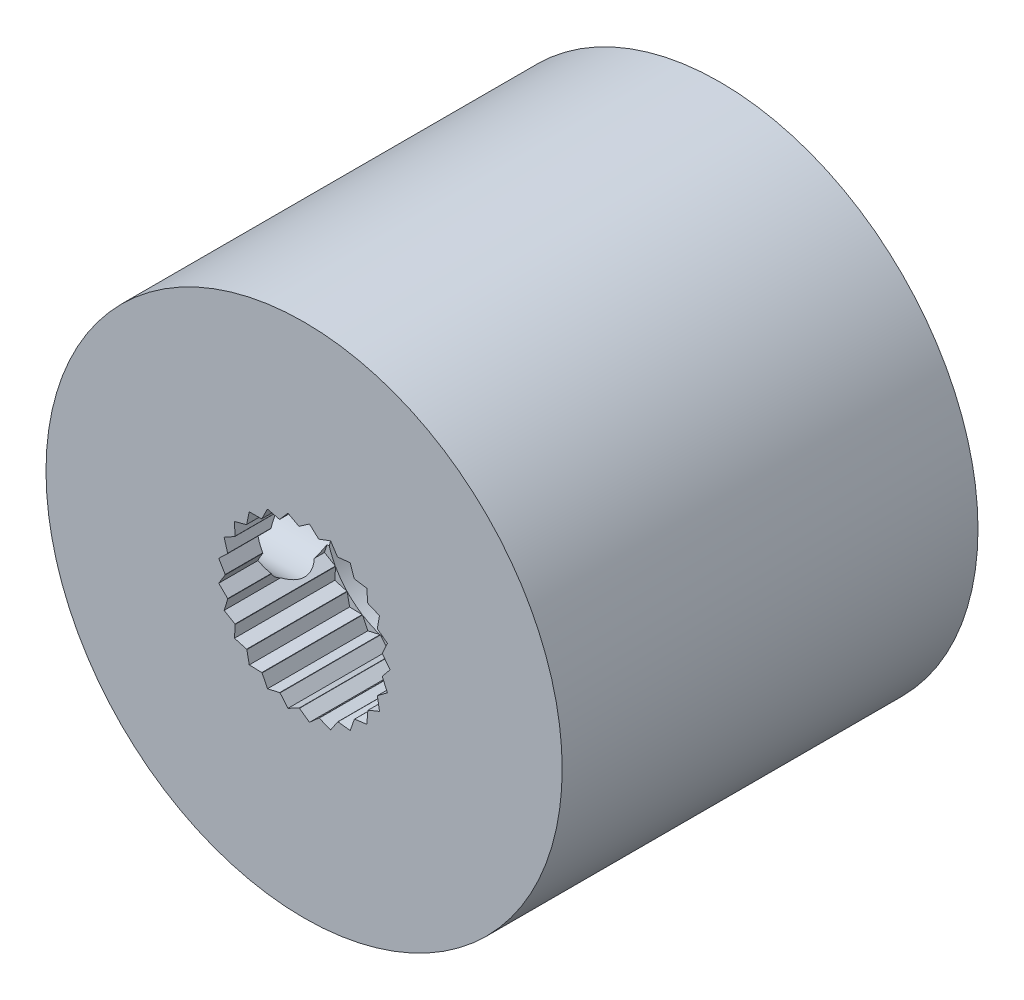
from build123d import *

# Parameters (mm, degrees)
SKETCH1_R           = 10
BOSS_EXTRUDE1_DEPTH = 2
SKETCH2_R           = 4.5
BOSS_EXTRUDE2_DEPTH = 2.5
SKETCH3_R           = 2.75
CUT_EXTRUDE1_DEPTH  = 5
CUT_EXTRUDE3_DEPTH  = 3.5
CIRPATTERN1_COUNT   = 25
SKETCH6_R           = 1.5
CUT_EXTRUDE4_DEPTH  = 15.361406616
FILLET1_R           = 0.1
THREAD1_PITCH       = 0.3175
CUT_EXTRUDE5_START  = -10
SKETCH7_R           = 11.568121222
SKETCH7_R_2         = 4.5
CUT_EXTRUDE5_DEPTH  = 10
BOSS_EXTRUDE3_START = 10
SKETCH8_R           = 4.5
BOSS_EXTRUDE3_DEPTH = 10
SKETCH9_R           = 9
SKETCH9_R_2         = 4.5
BOSS_EXTRUDE4_DEPTH = 14.5
CUT_EXTRUDE6_DEPTH  = 6
SKETCH11_R          = 1.25
CUT_EXTRUDE7_DEPTH  = 9


with BuildPart() as part:
    # Sketch1 → Boss-Extrude1 (new body)
    with BuildSketch(Plane.XY):
        Circle(SKETCH1_R)
    extrude(amount=BOSS_EXTRUDE1_DEPTH)

    # Sketch2 → Boss-Extrude2 (add)
    with BuildSketch(Plane.XY.offset(2)):
        Circle(SKETCH2_R)
    extrude(amount=BOSS_EXTRUDE2_DEPTH)

    # Sketch3 → Cut-Extrude1 (cut)
    with BuildSketch(Plane.XY.offset(4.5)):
        Circle(SKETCH3_R)
    extrude(amount=-CUT_EXTRUDE1_DEPTH, mode=Mode.SUBTRACT)

    # Sketch5 → Cut-Extrude3 (cut)
    with BuildSketch(Plane.XY.offset(4.5)):
        Polygon((-2.656507983, 0.682075321), (-2.682344512, 0.606240809), (-2.75, 0), (-2.976344104, 0.375999701), align=None)
    cut_extrude3 = extrude(amount=-CUT_EXTRUDE3_DEPTH, mode=Mode.SUBTRACT)

    # CirPattern1: Cut-Extrude3 ×25 about axis
    cirpattern1_axis = Axis((0, 0, 0), (0, 0, 1))
    for i in range(1, CIRPATTERN1_COUNT):
        add(cut_extrude3.rotate(cirpattern1_axis, i * 360 / CIRPATTERN1_COUNT), mode=Mode.SUBTRACT)

    # Sketch6 → Cut-Extrude4 (cut, through all)
    with BuildSketch(Plane.XY.offset(2)):
        with Locations((-7, 0)):
            Circle(SKETCH6_R)
        with Locations(Location((7, 0, 0), (0, 0, 180))):
            Circle(SKETCH6_R)
        with Locations(Location((0, 7, 0), (0, 0, 180))):
            Circle(SKETCH6_R)
        with Locations((0, -7)):
            Circle(SKETCH6_R)
    extrude(amount=-CUT_EXTRUDE4_DEPTH, mode=Mode.SUBTRACT)

    # Fillet1
    fillet1_edges = [part.edges().sort_by_distance(p)[0] for p in [
        (8.5, 0, 2),
    ]]
    fillet(fillet1_edges, radius=FILLET1_R)

    # Thread1: the profile of Thread Profile3 profile screwed along a right-hand helix of 6.299213 turns, 6 arcs to a turn; built about Z, then put on its axis
    thread1_z = Axis((0, 0, 0), (0, 0, 1))
    thread1_corners = [(1.5003, 0, -0.000173205), (1.5003, 0, 0.277985704), (1.328148085, 0, 0.17859375), (1.328148085, 0, 0.09921875)]
    with BuildLine(mode=Mode.PRIVATE) as thread1_profile:
        Line(thread1_corners[0], thread1_corners[1])
        Line(thread1_corners[1], thread1_corners[2])
        Line(thread1_corners[2], thread1_corners[3])
        Line(thread1_corners[3], thread1_corners[0])
    thread1_cap = Face(thread1_profile.wire())
    thread1_turn_angles = [0, 30, 60, 90, 120, 150, 180, 210, 240, 270, 300, 330, 360]
    thread1_turn_weights = [1, 0.8660254037844387, 1, 0.8660254037844387, 1, 0.8660254037844387, 1, 0.8660254037844387, 1, 0.8660254037844387, 1, 0.8660254037844387, 1]
    thread1_turn_rails = [Edge.make_bspline([Vector(p[0], p[1], 0).rotate(thread1_z, thread1_turn_angles[k]) / thread1_turn_weights[k] + Vector(0, 0, p[2] + THREAD1_PITCH * thread1_turn_angles[k] / 360) for k in range(13)], [0, 0, 0, 1, 1, 2, 2, 3, 3, 4, 4, 5, 5, 6, 6, 6], 2, thread1_turn_weights) for p in thread1_corners]
    thread1_turn_sides = [Face.make_surface_from_curves(thread1_turn_rails[p[0]], thread1_turn_rails[p[1]]) for p in [(0, 1), (1, 2), (2, 3), (3, 0)]]
    thread1_last_angles = [2160, 2190, 2220, 2243.858267717, 2267.716535433]
    thread1_last_weights = [1, 0.8660254037844387, 1, 0.9145488039507501, 1]
    thread1_last_rails = [Edge.make_bspline([Vector(p[0], p[1], 0).rotate(thread1_z, thread1_last_angles[k]) / thread1_last_weights[k] + Vector(0, 0, p[2] + THREAD1_PITCH * thread1_last_angles[k] / 360) for k in range(5)], [0, 0, 0, 1, 1, 2, 2, 2], 2, thread1_last_weights) for p in thread1_corners]
    thread1_last_sides = [Face.make_surface_from_curves(thread1_last_rails[p[0]], thread1_last_rails[p[1]]) for p in [(0, 1), (1, 2), (2, 3), (3, 0)]]
    thread1 = Plane(origin=(7, 0, 1.9), x_dir=(-1, 0, 0), z_dir=(0, 0, -1)) * Solid(Shell([*[p.moved(Location((0, 0, THREAD1_PITCH * i))) for i in range(6) for p in thread1_turn_sides], *thread1_last_sides, thread1_cap, thread1_cap.rotate(thread1_z, 2267.716535433).moved(Location((0, 0, THREAD1_PITCH * 2267.716535433 / 360)))]))
    add(thread1)

    # Sketch7 → Cut-Extrude5 (cut)
    with BuildSketch(Plane.XY.offset(4.5).offset(CUT_EXTRUDE5_START)):
        Circle(SKETCH7_R)
        Circle(SKETCH7_R_2, mode=Mode.SUBTRACT)
    extrude(amount=CUT_EXTRUDE5_DEPTH, mode=Mode.SUBTRACT)

    # Sketch8 → Boss-Extrude3 (add)
    with BuildSketch(Plane(origin=(0, 0, 0), x_dir=(-1, 0, 0), z_dir=(0, 0, -1)).offset(BOSS_EXTRUDE3_START)):
        Circle(SKETCH8_R)
    extrude(amount=-BOSS_EXTRUDE3_DEPTH)

    # Sketch9 → Boss-Extrude4 (add)
    # profile 1 of 2: a face of its own
    with BuildSketch(Plane(origin=(0, 0, -10), x_dir=(-1, 0, 0), z_dir=(0, 0, -1))):
        Circle(SKETCH9_R)
        Polygon((5, 2.886751346), (0, 5.773502692), (-5, 2.886751346), (-5, -2.886751346), (0, -5.773502692), (5, -2.886751346), align=None, mode=Mode.SUBTRACT)
    # profile 2 of 2: a face of its own
    with BuildSketch(Plane(origin=(0, 0, -10), x_dir=(-1, 0, 0), z_dir=(0, 0, -1))):
        Polygon((5, -2.886751346), (5, 2.886751346), (0, 5.773502692), (-5, 2.886751346), (-5, -2.886751346), (0, -5.773502692), align=None)
        Circle(SKETCH9_R_2, mode=Mode.SUBTRACT)
    extrude(amount=-BOSS_EXTRUDE4_DEPTH)

    # Sketch10 → Cut-Extrude6 (cut)
    with BuildSketch(Plane(origin=(0, 0, -10), x_dir=(-1, 0, 0), z_dir=(0, 0, -1))):
        Polygon((0, 7.505553499), (-6.5, 3.75277675), (-6.5, -3.75277675), (0, -7.505553499), (6.5, -3.75277675), (6.5, 3.75277675), align=None)
    extrude(amount=-CUT_EXTRUDE6_DEPTH, mode=Mode.SUBTRACT)

    # Sketch11 → Cut-Extrude7 (cut)
    with BuildSketch(Plane(origin=(0, 0, 0), x_dir=(0, 0, -1), z_dir=(1, 0, 0))):
        with Locations(Location((-1.940949094, 0, 0), (0, 0, 180.000000024))):
            Circle(SKETCH11_R)
        with Locations((7, 0)):
            Circle(SKETCH11_R)
    extrude(amount=-CUT_EXTRUDE7_DEPTH, mode=Mode.SUBTRACT)


solid = part.part
